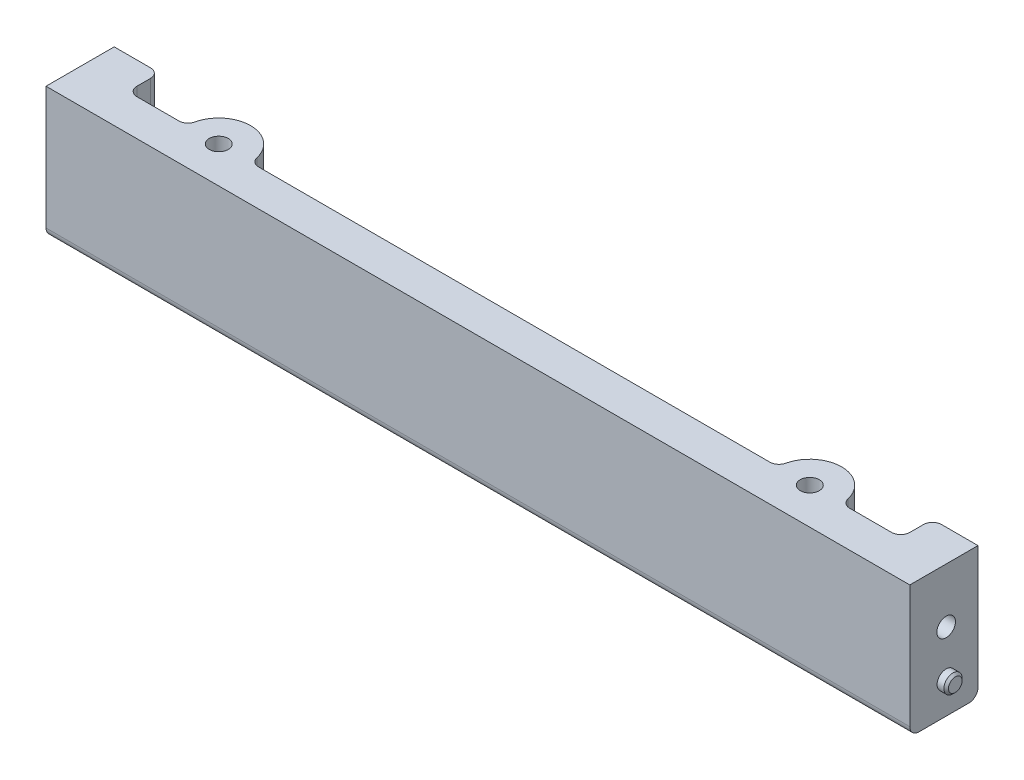
from build123d import *

# Parameters (mm, degrees)
BOSS_EXTRUDE1_DEPTH      = 190
SKETCH2_R                = 2.1
CUT_EXTRUDE1_DEPTH       = 193.574660846
CUT_EXTRUDE3_START       = -29
CUT_EXTRUDE3_DEPTH       = 29
FILLET1_R                = 2
CUT_EXTRUDE4_DEPTH       = 22
CUT_EXTRUDE5_REACH       = 183.805
SKETCH5_R                = 2.05
CUT_EXTRUDE6_START       = -4
CUT_EXTRUDE6_DEPTH       = 7.5
SKETCH6_R                = 2
BOSS_EXTRUDE2_DEPTH      = 2
CHAMFER1_SIZE            = 0.5
CHAMFER1_OF_MIRROR1_SIZE = 0.5
FILLET2_R                = 2


# Read off the part's stored shape, not the designer's step: Cut-Extrude3
with BuildPart() as part:
    # Sketch1 → Boss-Extrude1 (new body)
    with BuildSketch(Plane(origin=(0, 0, 0), x_dir=(0, 0, -1), z_dir=(1, 0, 0))):
        Polygon((-3, 6), (-3, 35), (12, 35), (12, 21.281778339), (12, 18), (12, 6), align=None)
    extrude(amount=BOSS_EXTRUDE1_DEPTH)

    # Sketch2 → Cut-Extrude1 (cut, through all)
    with BuildSketch(Plane(origin=(0, 35, 0), x_dir=(1, 0, 0), z_dir=(0, 1, 0))):
        with Locations(Location((160, 5, 0), (0, 0, 270))):
            Circle(SKETCH2_R)
        with Locations(Location((30, 5, 0), (0, 0, 270))):
            Circle(SKETCH2_R)
    extrude(amount=-CUT_EXTRUDE1_DEPTH, mode=Mode.SUBTRACT)

    # Cut-Extrude3 outline → Cut-Extrude3 (cut)
    with BuildSketch(Plane(origin=(0, 35, 0), x_dir=(1, 0, 0), z_dir=(0, 1, 0)).offset(CUT_EXTRUDE3_START)):
        with BuildLine():
            ThreePointArc((23, 5), (25.050252532, 9.949747468), (30, 12))
            Line((30, 12), (10, 12))
            Line((10, 12), (10, 5))
            Line((10, 5), (23, 5))
        make_face()
        with BuildLine():
            Line((180, 12), (160, 12))
            ThreePointArc((160, 12), (164.949747468, 9.949747468), (167, 5))
            Line((167, 5), (180, 5))
            Line((180, 5), (180, 12))
        make_face()
        with BuildLine():
            Line((37, 5), (153, 5))
            ThreePointArc((153, 5), (155.050252532, 9.949747468), (160, 12))
            Line((160, 12), (30, 12))
            ThreePointArc((30, 12), (34.949747468, 9.949747468), (37, 5))
        make_face()
    extrude(amount=CUT_EXTRUDE3_DEPTH, mode=Mode.SUBTRACT)

    # Fillet1
    fillet1_edges = [part.edges().sort_by_distance(p)[0] for p in [
        (10, 20.5, -5),
        (180, 20.5, -5),
    ]]
    fillet(fillet1_edges, radius=FILLET1_R)

    # Sketch4 → Cut-Extrude4 (cut)
    with BuildSketch(Plane.XZ.offset(-6)):
        Polygon((34.151410886, -4.276672839), (31.885792779, -0.8604896), (27.794482256, -1.114480816), (25.968789841, -4.784655272), (28.234407948, -8.200838512), (32.325718471, -7.946847295), align=None)
        Polygon((164.091310523, -4.746008784), (161.825692416, -1.329825544), (157.734381893, -1.583816761), (155.908689477, -5.253991216), (158.174307584, -8.670174456), (162.265618107, -8.416183239), align=None)
    extrude(amount=-CUT_EXTRUDE4_DEPTH, mode=Mode.SUBTRACT)

    # Sketch5 → Cut-Extrude5 (cut, up to next)
    with BuildSketch(Plane(origin=(178, 0, 0), x_dir=(0, 0, -1), z_dir=(1, 0, 0)), mode=Mode.PRIVATE) as cut_extrude5_sk1:
        with Locations(Location((5, 23, 0), (0, 0, 270))):
            Circle(SKETCH5_R)
    cut_extrude5_tool1 = extrude(cut_extrude5_sk1.sketch, amount=CUT_EXTRUDE5_REACH, mode=Mode.PRIVATE) & part.part
    cut_extrude5 = cut_extrude5_tool1.solids().sort_by_distance((178, 23, -5))[0]
    add(cut_extrude5, mode=Mode.SUBTRACT)

    # Sketch5<3> → Cut-Extrude6 (cut)
    with BuildSketch(Plane(origin=(178, 0, 0), x_dir=(0, 0, -1), z_dir=(1, 0, 0)).offset(CUT_EXTRUDE6_START)):
        Polygon((5, 18.900813089), (8.55, 20.950406544), (8.55, 25.049593456), (5, 27.099186911), (1.45, 25.049593456), (1.45, 20.950406544), align=None)
    cut_extrude6 = extrude(amount=CUT_EXTRUDE6_DEPTH, mode=Mode.SUBTRACT)

    # Sketch6 → Boss-Extrude2 (add)
    with BuildSketch(Plane(origin=(190, 0, 0), x_dir=(0, 0, -1), z_dir=(1, 0, 0))):
        with Locations((5, 13)):
            Circle(SKETCH6_R)
    boss_extrude2 = extrude(amount=BOSS_EXTRUDE2_DEPTH)

    # Chamfer1
    chamfer1_edges = [part.edges().sort_by_distance(p)[0] for p in [
        (192, 13, -3),
    ]]
    chamfer(chamfer1_edges, length=CHAMFER1_SIZE)

    # Mirror1: Cut-Extrude5, Cut-Extrude6, Boss-Extrude2 across plane
    add(cut_extrude5.mirror(Plane(origin=(95, 0, 0), x_dir=(0, 0, 1), z_dir=(1, 0, 0))), mode=Mode.SUBTRACT)
    add(cut_extrude6.mirror(Plane(origin=(95, 0, 0), x_dir=(0, 0, 1), z_dir=(1, 0, 0))), mode=Mode.SUBTRACT)
    add(boss_extrude2.mirror(Plane(origin=(95, 0, 0), x_dir=(0, 0, 1), z_dir=(1, 0, 0))))

    # Chamfer1 of Mirror1
    chamfer1_of_mirror1_edges = [part.edges().sort_by_distance(p)[0] for p in [
        (-2, 13, -3),
    ]]
    chamfer(chamfer1_of_mirror1_edges, length=CHAMFER1_OF_MIRROR1_SIZE)

    # Fillet2
    fillet2_edges = [part.edges().sort_by_distance(p)[0] for p in [
        (185, 6, -12),
        (95, 6, 3),
        (153, 20.5, -5),
        (37, 20.5, -5),
        (164.949747468, 6, -9.949747468),
        (95, 6, -5),
        (34.949747468, 6, -9.949747468),
        (5, 6, -12),
        (23, 20.5, -5),
        (10, 6, -9.5),
        (10, 20.5, -12),
        (167, 20.5, -5),
        (180, 20.5, -12),
        (180, 6, -9.5),
        (17.5, 6, -5),
        (172.5, 6, -5),
        (10.585786438, 6, -5.585786438),
        (179.414213562, 6, -5.585786438),
    ]]
    fillet(fillet2_edges, radius=FILLET2_R)


solid = part.part
